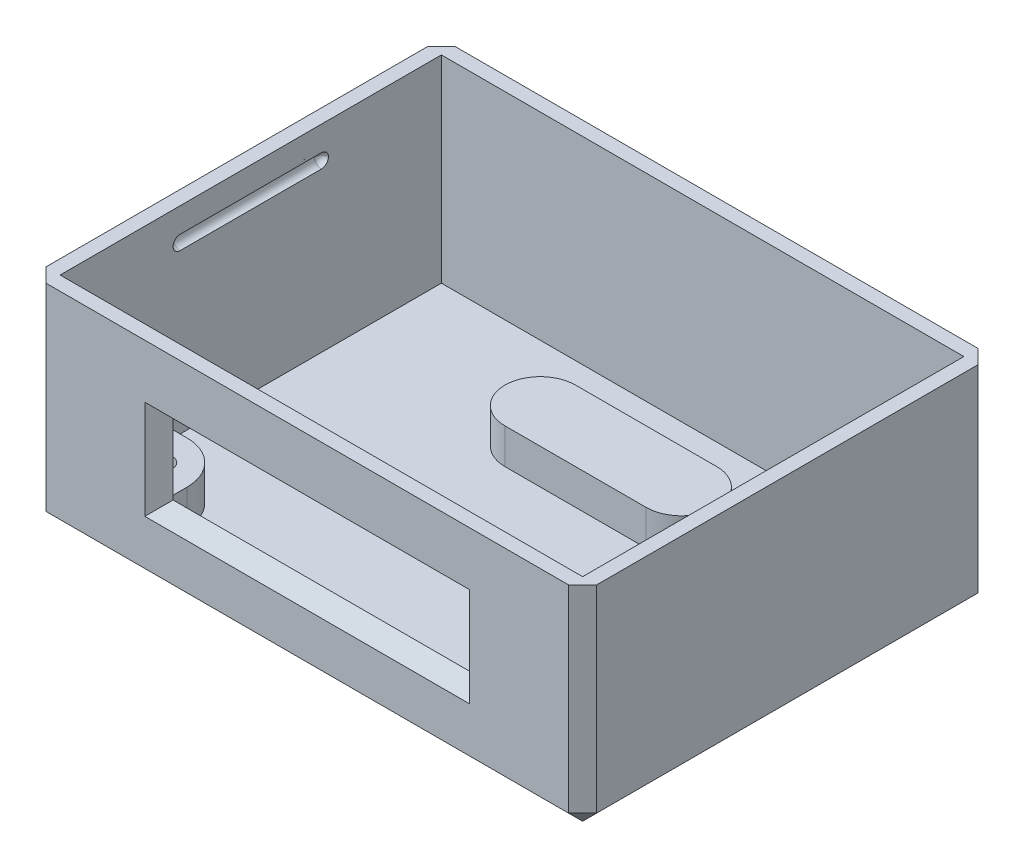
from build123d import *

# Parameters (mm, degrees)
SKETCH1_W            = 39
SKETCH1_H            = 29
BOSS_EXTRUDE1_DEPTH  = 15
SKETCH2_W            = 37
SKETCH2_H            = 27
CUT_EXTRUDE1_DEPTH   = 14
CHAMFER1_SIZE        = 1
CUT_EXTRUDE2_REACH   = 40.03
SKETCH3_W            = 21
SKETCH3_H            = 5
SKETCH4_W            = 11
SKETCH4_H            = 1
CUT_EXTRUDE3_DEPTH   = 0.5
FILLET1_R            = 0.5
FILLET1_OF_MIRROR2_R = 0.5
SKETCH5_R            = 0.75
BOSS_EXTRUDE2_DEPTH  = 2.5
CHAMFER2_SIZE        = 1


with BuildPart() as part:
    # Sketch1 → Boss-Extrude1 (new body)
    with BuildSketch(Plane(origin=(0, 0, 0), x_dir=(1, 0, 0), z_dir=(0, 1, 0))):
        Rectangle(SKETCH1_W, SKETCH1_H)
    extrude(amount=BOSS_EXTRUDE1_DEPTH)

    # Sketch2 → Cut-Extrude1 (cut)
    with BuildSketch(Plane(origin=(0, 15, 0), x_dir=(1, 0, 0), z_dir=(0, 1, 0))):
        Rectangle(SKETCH2_W, SKETCH2_H)
    extrude(amount=-CUT_EXTRUDE1_DEPTH, mode=Mode.SUBTRACT)

    # Chamfer1
    chamfer1_edges = [part.edges().sort_by_distance(p)[0] for p in [
        (0, 0, 14.5),
        (-19.5, 0, 0),
        (0, 0, -14.5),
        (19.5, 0, 0),
        (19.5, 7.5, 14.5),
        (-19.5, 7.5, 14.5),
        (-19.5, 7.5, -14.5),
        (19.5, 7.5, -14.5),
    ]]
    chamfer(chamfer1_edges, length=CHAMFER1_SIZE)

    # Sketch3 → Cut-Extrude2 (cut, up to next)
    with BuildSketch(Plane.XY.offset(14.5), mode=Mode.PRIVATE) as cut_extrude2_sk1:
        with Locations((0, 7.7)):
            Rectangle(SKETCH3_W, SKETCH3_H)
    cut_extrude2_tool1 = extrude(cut_extrude2_sk1.sketch, amount=-CUT_EXTRUDE2_REACH, mode=Mode.PRIVATE) & part.part
    add(cut_extrude2_tool1.solids().sort_by_distance((0, 7.7, 14.5))[0], mode=Mode.SUBTRACT)

    # Sketch4 → Cut-Extrude3 (cut)
    with BuildSketch(Plane(origin=(-18.5, 0, 0), x_dir=(0, 0, -1), z_dir=(1, 0, 0))):
        with Locations((0, 12.75)):
            Rectangle(SKETCH4_W, SKETCH4_H)
    cut_extrude3 = extrude(amount=-CUT_EXTRUDE3_DEPTH, mode=Mode.SUBTRACT)

    # Fillet1
    fillet1_edges = [part.edges().sort_by_distance(p)[0] for p in [
        (-19, 12.75, 5.5),
    ]]
    fillet(fillet1_edges, radius=FILLET1_R - 0.0001)  # a hair under: the kernel refuses the full size
    fillet1_2_edges = [part.edges().sort_by_distance(p)[0] for p in [
        (-19, 13.25, -0.24995),
    ]]
    fillet(fillet1_2_edges, radius=FILLET1_R - 0.0001)  # a hair under: the kernel refuses the full size
    fillet1_3_edges = [part.edges().sort_by_distance(p)[0] for p in [
        (-19, 12.50005, -5.5),
    ]]
    fillet(fillet1_3_edges, radius=FILLET1_R - 0.0001)  # a hair under: the kernel refuses the full size
    fillet1_4_edges = [part.edges().sort_by_distance(p)[0] for p in [
        (-19, 12.25, 0),
    ]]
    fillet(fillet1_4_edges, radius=FILLET1_R - 0.0001)  # a hair under: the kernel refuses the full size

    # Mirror2: Cut-Extrude3 across plane
    add(cut_extrude3.mirror(Plane(origin=(0, 0, 0), x_dir=(0, 0, 1), z_dir=(1, 0, 0))), mode=Mode.SUBTRACT)

    # Fillet1 of Mirror2
    fillet1_of_mirror2_edges = [part.edges().sort_by_distance(p)[0] for p in [
        (19, 12.25, 0),
    ]]
    fillet(fillet1_of_mirror2_edges, radius=FILLET1_OF_MIRROR2_R - 0.0001)  # a hair under: the kernel refuses the full size
    fillet1_of_mirror2_2_edges = [part.edges().sort_by_distance(p)[0] for p in [
        (19, 12.99995, -5.5),
    ]]
    fillet(fillet1_of_mirror2_2_edges, radius=FILLET1_OF_MIRROR2_R - 0.0001)  # a hair under: the kernel refuses the full size
    fillet1_of_mirror2_3_edges = [part.edges().sort_by_distance(p)[0] for p in [
        (19, 13.25, 0.24995),
    ]]
    fillet(fillet1_of_mirror2_3_edges, radius=FILLET1_OF_MIRROR2_R - 0.0001)  # a hair under: the kernel refuses the full size
    fillet1_of_mirror2_4_edges = [part.edges().sort_by_distance(p)[0] for p in [
        (19, 12.75, 5.5),
    ]]
    fillet(fillet1_of_mirror2_4_edges, radius=FILLET1_OF_MIRROR2_R - 0.0001)  # a hair under: the kernel refuses the full size

    # Sketch5 → Boss-Extrude2 (add)
    # profile 1 of 3: a face of its own
    with BuildSketch(Plane(origin=(0, 1, 0), x_dir=(1, 0, 0), z_dir=(0, 1, 0))):
        with BuildLine():
            Line((-18.5, -13.5), (-12.5, -13.5))
            Line((-12.5, -13.5), (-12.5, -10.5))
            ThreePointArc((-12.5, -10.5), (-13.378679656, -8.378679656), (-15.5, -7.5))
            Line((-15.5, -7.5), (-18.5, -7.5))
            Line((-18.5, -7.5), (-18.5, -13.5))
        make_face()
        with Locations(Location((-14.9, -9.9, 0), (0, 0, 270))):
            Circle(SKETCH5_R, mode=Mode.SUBTRACT)
    # profile 2 of 3: a face of its own
    with BuildSketch(Plane(origin=(0, 1, 0), x_dir=(1, 0, 0), z_dir=(0, 1, 0))):
        with BuildLine():
            Line((-5, 9.5), (5, 9.5))
            ThreePointArc((5, 9.5), (7.5, 7), (5, 4.5))
            Line((5, 4.5), (-5, 4.5))
            ThreePointArc((-5, 4.5), (-7.5, 7), (-5, 9.5))
        make_face()
    # profile 3 of 3: a face of its own
    with BuildSketch(Plane(origin=(0, 1, 0), x_dir=(1, 0, 0), z_dir=(0, 1, 0))):
        with BuildLine():
            Line((12.5, -13.5), (12.5, -10.5))
            ThreePointArc((12.5, -10.5), (13.378679656, -8.378679656), (15.5, -7.5))
            Line((15.5, -7.5), (18.5, -7.5))
            Line((18.5, -7.5), (18.5, -13.5))
            Line((18.5, -13.5), (12.5, -13.5))
        make_face()
        with Locations(Location((14.9, -9.9, 0), (0, 0, 90))):
            Circle(SKETCH5_R, mode=Mode.SUBTRACT)
    extrude(amount=BOSS_EXTRUDE2_DEPTH)

    # Chamfer2
    chamfer2_edges = [part.edges().sort_by_distance(p)[0] for p in [
        (-10.5, 7.7, 14.5),
        (0, 5.2, 14.5),
        (10.5, 7.7, 14.5),
        (0, 10.2, 14.5),
    ]]
    chamfer(chamfer2_edges, length=CHAMFER2_SIZE - 0.0001)  # a hair under: the kernel refuses the full size


solid = part.part
